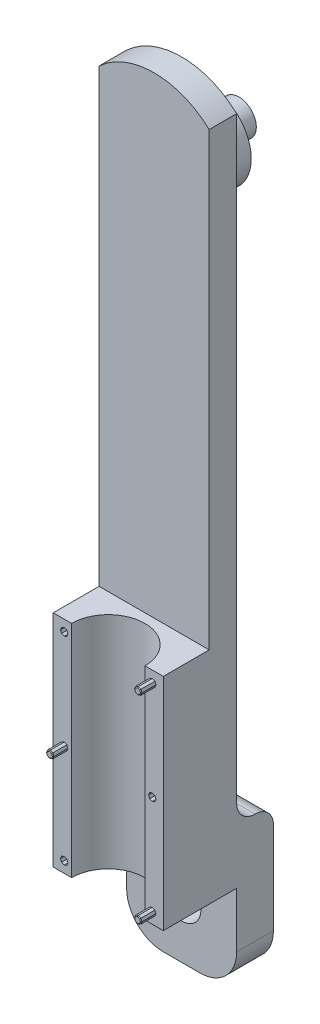
from build123d import *

# Parameters (mm, degrees)
SKETCH2_W                  = 30
SKETCH2_H                  = 30
BOSS_EXTRUDE1_DEPTH        = 60
FILLET1_R                  = 10
SKETCH3_W                  = 40
SKETCH3_H                  = 25
CUT_EXTRUDE1_DEPTH         = 69.738635424
SKETCH6_W                  = 30
SKETCH6_H                  = 40
BOSS_EXTRUDE2_DEPTH        = 125
SKETCH7_W                  = 30
SKETCH7_H                  = 10
BOSS_EXTRUDE3_DEPTH        = 10
FILLET2_START              = -16
FILLET2_DEPTH              = 32
FILLET2_START_2            = -15
FILLET2_2_DEPTH            = 30
SKETCH8_W                  = 25
SKETCH8_H                  = 70
CUT_EXTRUDE2_DEPTH         = 156.241746963
SKETCH12_W                 = 30
SKETCH12_H                 = 7.5
BOSS_EXTRUDE4_DEPTH        = 65
SKETCH13_W                 = 20
SKETCH13_H                 = 54
CUT_EXTRUDE6_DEPTH         = 6
SKETCH20_R                 = 4.75
AXIS_BASE_DEPTH            = 49.6
CUT_EXTRUDE8_DEPTH         = 212.541958013
CUT_EXTRUDE8_DEPTH_BACK    = 212.541958013
SKETCH19_R                 = 2.5
SKETCH19_W                 = 20
SKETCH19_H                 = 42
CUT_EXTRUDE7_DEPTH         = 26.5
MAKE_HALF_DEPTH            = 225.175347112
ONE_MALE_JACK_DEPTH        = 4
CHAMFER1_SIZE              = 0.2
LPATTERN1_COUNT            = 2
LPATTERN1_PITCH            = 24
LPATTERN1_COUNT_DIR2       = 3
LPATTERN1_PITCH_DIR2       = 27
CHAMFER1_OF_LPATTERN1_SIZE = 0.2
ONE_FEMALE_JACK_DEPTH      = 5
FEMALE_JACKS_COUNT         = 2
FEMALE_JACKS_PITCH         = 24
FEMALE_JACKS_COUNT_DIR2    = 3
FEMALE_JACKS_PITCH_DIR2    = 27
SKETCH26_R                 = 10
MAKE_LIGHER_DEPTH          = 60
SKETCH27_R                 = 11.517379081
BOSS_EXTRUDE5_DEPTH        = 7.45


with BuildPart() as part:
    # Sketch2 → Boss-Extrude1 (new body)
    with BuildSketch(Plane.XY):
        Rectangle(SKETCH2_W, SKETCH2_H)
        with BuildLine():
            ThreePointArc((5.25, 0), (-2.561737691, -4.582575695), (-2.75, 4.472135955))
            Line((-2.75, 4.472135955), (-2.75, 8.5))
            Line((-2.75, 8.5), (0, 8.5))
            Line((0, 8.5), (2.75, 8.5))
            Line((2.75, 8.5), (2.75, 4.472135955))
            ThreePointArc((2.75, 4.472135955), (4.582575695, 2.561737691), (5.25, 0))
        make_face(mode=Mode.SUBTRACT)
    extrude(amount=BOSS_EXTRUDE1_DEPTH)

    # Fillet1
    fillet1_edges = [part.edges().sort_by_distance(p)[0] for p in [
        (15, -15, 30),
        (-15, -15, 30),
    ]]
    fillet(fillet1_edges, radius=FILLET1_R)

    # Sketch3 → Cut-Extrude1 (cut, through all)
    with BuildSketch(Plane.ZY.offset(15)):
        with Locations((30, -2.5)):
            Rectangle(SKETCH3_W, SKETCH3_H)
    extrude(amount=-CUT_EXTRUDE1_DEPTH, mode=Mode.SUBTRACT)

    # Sketch6 → Boss-Extrude2 (add)
    with BuildSketch(Plane(origin=(0, 15, 0), x_dir=(1, 0, 0), z_dir=(0, 1, 0))):
        with Locations((0, -30)):
            Rectangle(SKETCH6_W, SKETCH6_H)
    extrude(amount=BOSS_EXTRUDE2_DEPTH)

    # Sketch7 → Boss-Extrude3 (add)
    with BuildSketch(Plane(origin=(0, 15, 0), x_dir=(1, 0, 0), z_dir=(0, 1, 0))):
        with Locations((0, -5)):
            Rectangle(SKETCH7_W, SKETCH7_H)
        with Locations((0, -55)):
            Rectangle(SKETCH7_W, SKETCH7_H)
    extrude(amount=BOSS_EXTRUDE3_DEPTH)

    # Fillet2: read off the stored shape, not the designer's step
    # Fillet2 outline → Fillet2 (cut)
    with BuildSketch(Plane.YZ.offset(FILLET2_START)):
        with BuildLine():
            ThreePointArc((25, 5), (23.535533906, 1.464466094), (20, 0))
            Line((20, 0), (25, 0))
            Line((25, 0), (25, 5))
        make_face()
        with BuildLine():
            Line((25, 60), (20, 60))
            ThreePointArc((20, 60), (23.535533906, 58.535533906), (25, 55))
            Line((25, 55), (25, 60))
        make_face()
    extrude(amount=FILLET2_DEPTH, mode=Mode.SUBTRACT)

    # Fillet2 2 outline → Fillet2 2 (add)
    with BuildSketch(Plane.YZ.offset(FILLET2_START_2)):
        with BuildLine():
            Line((25, 10), (25, 5))
            ThreePointArc((25, 5), (26.464466094, 8.535533906), (30, 10))
            Line((30, 10), (25, 10))
        make_face()
        with BuildLine():
            ThreePointArc((30, 50), (26.464466094, 51.464466094), (25, 55))
            Line((25, 55), (25, 50))
            Line((25, 50), (30, 50))
        make_face()
    extrude(amount=FILLET2_2_DEPTH)

    # Sketch8 → Cut-Extrude2 (cut, through all)
    with BuildSketch(Plane(origin=(15, 0, 0), x_dir=(0, 0, -1), z_dir=(1, 0, 0))):
        with Locations((-30, 105)):
            Rectangle(SKETCH8_W, SKETCH8_H)
    extrude(amount=-CUT_EXTRUDE2_DEPTH, mode=Mode.SUBTRACT)

    # Sketch12 → Boss-Extrude4 (add)
    with BuildSketch(Plane(origin=(0, 140, 0), x_dir=(1, 0, 0), z_dir=(0, 1, 0))):
        with Locations((0, -13.75)):
            Rectangle(SKETCH12_W, SKETCH12_H)
        with Locations((0, -46.25)):
            Rectangle(SKETCH12_W, SKETCH12_H)
    extrude(amount=BOSS_EXTRUDE4_DEPTH)

    # Sketch13 → Cut-Extrude6 (cut)
    with BuildSketch(Plane.XY.offset(50)):
        with Locations((0, 168)):
            Rectangle(SKETCH13_W, SKETCH13_H)
    extrude(amount=-CUT_EXTRUDE6_DEPTH, mode=Mode.SUBTRACT)

    # Sketch20 → Axis Base (add)
    with BuildSketch(Plane.XY.offset(44)):
        with Locations(Location((0, 176.7, 0), (0, 0, 90))):
            Circle(SKETCH20_R)
    extrude(amount=-AXIS_BASE_DEPTH)

    # Sketch23 → Cut-Extrude8 (cut, two sides: drawn at the far end of the back side and taken through both)
    with BuildSketch(Plane(origin=(0, 0, 10), x_dir=(-1, 0, 0), z_dir=(0, 0, -1)).offset(-CUT_EXTRUDE8_DEPTH_BACK)):
        with BuildLine():
            Line((-15, 192.793476939), (-15, 205))
            Line((-15, 205), (15, 205))
            Line((15, 205), (15, 192.793476939))
            ThreePointArc((15, 192.793476939), (0, 198.7), (-15, 192.793476939))
        make_face()
    extrude(amount=CUT_EXTRUDE8_DEPTH + CUT_EXTRUDE8_DEPTH_BACK, mode=Mode.SUBTRACT)

    # Sketch19 → Cut-Extrude7 (cut)
    with BuildSketch(Plane.XY.offset(44)):
        with Locations((-5.12, 192)):
            Circle(SKETCH19_R)
        with Locations(Location((5.12, 192, 0), (0, 0, 270))):
            Circle(SKETCH19_R)
        with Locations((5.12, 144)):
            Circle(SKETCH19_R)
        with Locations(Location((-5.12, 144, 0), (0, 0, 270))):
            Circle(SKETCH19_R)
        with Locations((0, 168)):
            Rectangle(SKETCH19_W, SKETCH19_H)
    extrude(amount=-CUT_EXTRUDE7_DEPTH, mode=Mode.SUBTRACT)

    # 3DSketch2 → Make Half (cut, through all)
    with BuildSketch(Plane(origin=(-16.97773478, -20.308334844, 30), x_dir=(0.14055892995616934, 0.9900723141314359, 0), z_dir=(0, 0, 1))):
        Polygon((0, 0), (4.55547701, -32.087976668), (230.577525736, 0), (226.022048726, 32.087976668), align=None)
    extrude(amount=MAKE_HALF_DEPTH, mode=Mode.SUBTRACT)

    # Sketch24 → One Male Jack (add)
    with BuildSketch(Plane.XY.offset(30)):
        Polygon((12, 68), (11.292893219, 67.707106781), (11, 67), (11.292893219, 66.292893219), (12, 66), (12.707106781, 66.292893219), (13, 67), (12.707106781, 67.707106781), align=None)
    one_male_jack = extrude(amount=ONE_MALE_JACK_DEPTH)

    # Chamfer1
    chamfer1_edges = [part.edges().sort_by_distance(p)[0] for p in [
        (12.353553391, 67.853553391, 34),
        (11.646446609, 67.853553391, 34),
        (11.146446609, 67.353553391, 34),
        (11.146446609, 66.646446609, 34),
        (11.646446609, 66.146446609, 34),
        (12.353553391, 66.146446609, 34),
        (12.853553391, 66.646446609, 34),
        (12.853553391, 67.353553391, 34),
    ]]
    chamfer(chamfer1_edges, length=CHAMFER1_SIZE)

    # LPattern1: One Male Jack 2 × 3, 3 skipped
    with Locations(*[(-i * LPATTERN1_PITCH, -j * LPATTERN1_PITCH_DIR2, 0) for i in range(LPATTERN1_COUNT) for j in range(LPATTERN1_COUNT_DIR2) if (i, j) not in ((0, 0), (0, 1), (1, 0), (1, 2))]):
        add(one_male_jack)

    # Chamfer1 of LPattern1
    chamfer1_of_lpattern1_edges = [part.edges().sort_by_distance(p)[0] for p in [
        (12.353553391, 13.853553391, 34),
        (11.646446609, 13.853553391, 34),
        (11.146446609, 13.353553391, 34),
        (11.146446609, 12.646446609, 34),
        (11.646446609, 12.146446609, 34),
        (12.353553391, 12.146446609, 34),
        (12.853553391, 12.646446609, 34),
        (12.853553391, 13.353553391, 34),
        (-11.646446609, 40.853553391, 34),
        (-12.353553391, 40.853553391, 34),
        (-12.853553391, 40.353553391, 34),
        (-12.853553391, 39.646446609, 34),
        (-12.353553391, 39.146446609, 34),
        (-11.646446609, 39.146446609, 34),
        (-11.146446609, 39.646446609, 34),
        (-11.146446609, 40.353553391, 34),
    ]]
    chamfer(chamfer1_of_lpattern1_edges, length=CHAMFER1_OF_LPATTERN1_SIZE)

    # Sketch25 → One Female Jack (cut)
    with BuildSketch(Plane.XY.offset(30)):
        Polygon((-12, 68.025), (-12.724784451, 67.724784451), (-13.025, 67), (-12.724784451, 66.275215549), (-12, 65.975), (-11.275215549, 66.275215549), (-10.975, 67), (-11.275215549, 67.724784451), align=None)
    one_female_jack = extrude(amount=-ONE_FEMALE_JACK_DEPTH, mode=Mode.SUBTRACT)

    # Female Jacks: One Female Jack 2 × 3, 3 skipped
    with Locations(*[(i * FEMALE_JACKS_PITCH, -j * FEMALE_JACKS_PITCH_DIR2, 0) for i in range(FEMALE_JACKS_COUNT) for j in range(FEMALE_JACKS_COUNT_DIR2) if (i, j) not in ((0, 0), (0, 1), (1, 0), (1, 2))]):
        add(one_female_jack, mode=Mode.SUBTRACT)

    # Sketch26 → Make Ligher (cut)
    with BuildSketch(Plane.XZ.offset(-10)):
        with Locations((0, 30)):
            Circle(SKETCH26_R)
    extrude(amount=-MAKE_LIGHER_DEPTH, mode=Mode.SUBTRACT)

    # Sketch27 → Boss-Extrude5 (add)
    with BuildSketch(Plane(origin=(0, 0, 10), x_dir=(-1, 0, 0), z_dir=(0, 0, -1))):
        with Locations(Location((0, 176.7, 0), (0, 0, 180))):
            Circle(SKETCH27_R)
    extrude(amount=BOSS_EXTRUDE5_DEPTH)


solid = part.part
